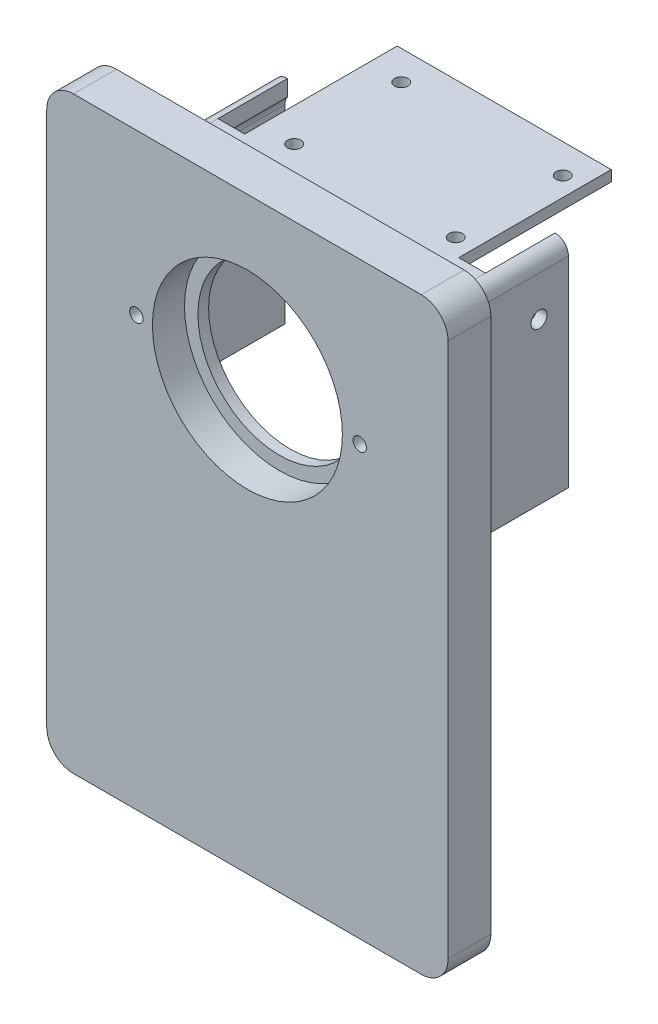
from build123d import *

# Parameters (mm, degrees)
SALIENTE_EXTRUIR1_DEPTH = 16
CROQUIS3_R              = 30.5
CORTAR_EXTRUIR3_DEPTH   = 135.093251135
CROQUIS4_R              = 35.5
CORTAR_EXTRUIR4_DEPTH   = 12
SALIENTE_EXTRUIR2_DEPTH = 49
CROQUIS6_W              = 80
CROQUIS6_H              = 62
SALIENTE_EXTRUIR4_DEPTH = 4
CROQUIS8_W              = 10
CROQUIS8_H              = 34.666666667
CORTAR_EXTRUIR6_DEPTH   = 229.089894559
CROQUIS9_R              = 3
CORTAR_EXTRUIR7_DEPTH   = 189.148877222
REDONDEO1_R             = 5
CROQUIS10_R             = 2.5
CORTAR_EXTRUIR8_DEPTH   = 156.32224567
CROQUIS11_R             = 2.5
CORTAR_EXTRUIR9_DEPTH   = 10


with BuildPart() as part:
    # Croquis2 → Saliente-Extruir1 (new body)
    with BuildSketch(Plane.XY):
        with BuildLine():
            Line((-65, 110), (65, 110))
            ThreePointArc((65, 110), (72.071067812, 107.071067812), (75, 100))
            Line((75, 100), (75, -100))
            ThreePointArc((75, -100), (72.071067812, -107.071067812), (65, -110))
            Line((65, -110), (-65, -110))
            ThreePointArc((-65, -110), (-72.071067812, -107.071067812), (-75, -100))
            Line((-75, -100), (-75, 100))
            ThreePointArc((-75, 100), (-72.071067812, 107.071067812), (-65, 110))
        make_face()
    extrude(amount=SALIENTE_EXTRUIR1_DEPTH)

    # Croquis3 → Cortar-Extruir3 (cut, through all)
    with BuildSketch(Plane.XY.offset(16)):
        with Locations((0, 50)):
            Circle(CROQUIS3_R)
    extrude(amount=-CORTAR_EXTRUIR3_DEPTH, mode=Mode.SUBTRACT)

    # Croquis4 → Cortar-Extruir4 (cut)
    with BuildSketch(Plane.XY.offset(16)):
        with Locations((0, 50)):
            Circle(CROQUIS4_R)
    extrude(amount=-CORTAR_EXTRUIR4_DEPTH, mode=Mode.SUBTRACT)

    # Croquis5 → Saliente-Extruir2 (add)
    with BuildSketch(Plane(origin=(0, 0, 0), x_dir=(-1, 0, 0), z_dir=(0, 0, -1))):
        Polygon((-55, 83), (-55, 10), (-51, 10), (-51, 79), (-51, 86), (-44, 86), (44, 86), (51, 86), (51, 79), (51, 10), (55, 10), (55, 83), (55, 90), (48, 90), (-48, 90), (-55, 90), align=None)
    extrude(amount=SALIENTE_EXTRUIR2_DEPTH)

    # Croquis6 → Saliente-Extruir4 (add)
    with BuildSketch(Plane(origin=(0, 90, 0), x_dir=(1, 0, 0), z_dir=(0, 1, 0))):
        with Locations((0, 49)):
            Rectangle(CROQUIS6_W, CROQUIS6_H)
    extrude(amount=-SALIENTE_EXTRUIR4_DEPTH)

    # Croquis8 → Cortar-Extruir6 (cut, through all)
    with BuildSketch(Plane(origin=(0, 90, 0), x_dir=(1, 0, 0), z_dir=(0, 1, 0))):
        with Locations((-45, 40.333333334)):
            Rectangle(CROQUIS8_W, CROQUIS8_H)
        with Locations((45, 40.333333334)):
            Rectangle(CROQUIS8_W, CROQUIS8_H)
    extrude(amount=-CORTAR_EXTRUIR6_DEPTH, mode=Mode.SUBTRACT)

    # Croquis9 → Cortar-Extruir7 (cut, through all)
    with BuildSketch(Plane(origin=(55, 0, 0), x_dir=(0, 0, -1), z_dir=(1, 0, 0))):
        with Locations((38, 70)):
            Circle(CROQUIS9_R)
    extrude(amount=-CORTAR_EXTRUIR7_DEPTH, mode=Mode.SUBTRACT)

    # Redondeo1
    redondeo1_edges = [part.edges().sort_by_distance(p)[0] for p in [
        (-51, 86, -24.5),
        (51, 86, -24.5),
        (55, 90, -24.5),
        (-55, 90, -24.5),
    ]]
    fillet(redondeo1_edges, radius=REDONDEO1_R - 0.0001)  # a hair under: the kernel refuses the full size

    # Croquis10 → Cortar-Extruir8 (cut, through all)
    with BuildSketch(Plane(origin=(0, 0, 0), x_dir=(-1, 0, 0), z_dir=(0, 0, -1))):
        with Locations((-42, 50.158024554)):
            Circle(CROQUIS10_R)
        with Locations((41.5, 50.158024554)):
            Circle(CROQUIS10_R)
    extrude(amount=-CORTAR_EXTRUIR8_DEPTH, mode=Mode.SUBTRACT)

    # Croquis11 → Cortar-Extruir9 (cut)
    with BuildSketch(Plane.XZ.offset(-86)):
        with Locations(Location((32.851728302, -29, 0), (0, 0, 270))):
            Circle(CROQUIS11_R)
        with Locations(Location((32.851728302, -69, 0), (0, 0, 270))):
            Circle(CROQUIS11_R)
        with Locations(Location((-27.516343247, -69, 0), (0, 0, 270))):
            Circle(CROQUIS11_R)
        with Locations(Location((-27.516343247, -29, 0), (0, 0, 270))):
            Circle(CROQUIS11_R)
    extrude(amount=-CORTAR_EXTRUIR9_DEPTH, mode=Mode.SUBTRACT)


solid = part.part
